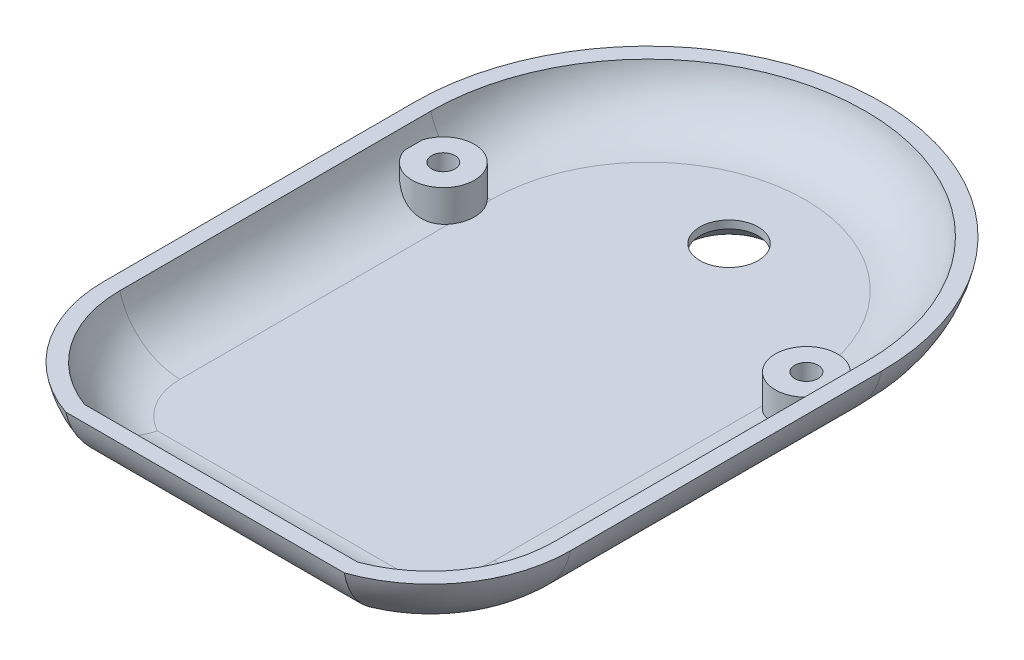
from build123d import *

# Parameters (mm, degrees)
EXTRUDE_1_DEPTH          = 8
FILLET_1_R               = 10
SHELL_2_T                = -2
EXTRUDE_2_REACH          = 73.465
SKETCH_2_R               = 4
SKETCH_2_R_2             = 1.5
SKETCH_3_R               = 7
EXTRUDE_5_DEPTH          = 1
CUT_EXTRUDE_2_DEPTH      = 70.685831359
CUT_EXTRUDE_2_DEPTH_BACK = 70.685831359
SKETCH_5_R               = 3.75
CHAMFER_3_SIZE           = 2


with BuildPart() as part:
    # 草图1 → 凸台-拉伸1 (new body)
    with BuildSketch(Plane(origin=(0, 0, 0), x_dir=(1, 0, 0), z_dir=(0, 1, 0))):
        with BuildLine():
            Line((-27.716535433, 33.464566929), (-27.716535433, -6.535433071))
            ThreePointArc((-27.716535433, -6.535433071), (-24.387756175, -16.964013125), (-15.632615216, -23.535433071))
            Line((-15.632615216, -23.535433071), (20.19954435, -23.535433071))
            ThreePointArc((20.19954435, -23.535433071), (28.954685308, -16.964013125), (32.283464567, -6.535433071))
            Line((32.283464567, -6.535433071), (32.283464567, 33.464566929))
            ThreePointArc((32.283464567, 33.464566929), (2.283464567, 63.464566929), (-27.716535433, 33.464566929))
        make_face()
    extrude(amount=EXTRUDE_1_DEPTH)

    # 圆角1
    # the kernel refuses this fillet: 10 mm, written as the material it takes off along each edge
    with BuildSketch(Plane(origin=(-40.127512644, 0, 23.535433071), x_dir=(0, 1, 0), z_dir=(1, 0, 0))) as fillet_1_piece_1:
        with BuildLine():
            CenterArc((10, -9.797958971), FILLET_1_R, 101.536959033, 78.463040967)
            Line((0, -9.797958971), (0, 0))
            Line((0, 0), (8, 0))
        make_face()
    extrude(amount=84.821954422, mode=Mode.SUBTRACT)
    # the kernel refuses this fillet: 10 mm, written as the material it takes off along each edge
    with BuildSketch(Plane(origin=(-27.716535433, 0, -33.464566929), x_dir=(0, 1, 0), z_dir=(0, 0, 1))) as fillet_1_2_piece_1:
        with BuildLine():
            CenterArc((10, -9.797958971), FILLET_1_R, 101.536959033, 78.463040967)
            Line((0, -9.797958971), (0, 0))
            Line((0, 0), (8, 0))
        make_face()
    extrude(amount=40, mode=Mode.SUBTRACT)
    with BuildSketch(Plane(origin=(-9.716535433, 0, 6.535433071), x_dir=(-1, 0, 0), z_dir=(0, 0, -1))) as fillet_1_2_piece_2:
        with BuildLine():
            CenterArc((8.202041029, 10), FILLET_1_R, 270, 78.463040967)
            Line((8.202041029, 0), (18, 0))
            Line((18, 0), (18, 8))
        make_face()
    revolve(axis=Axis((-9.716535433, 0, 6.535433071), (0, 1, 0)), revolution_arc=101.557097779, mode=Mode.SUBTRACT)
    with BuildSketch(Plane(origin=(14.283464567, 0, 6.535433071), x_dir=(-0.20034437358478865, 0, 0.9797255391041507), z_dir=(-0.9797255391041507, 0, -0.20034437358478865))) as fillet_1_2_piece_3:
        with BuildLine():
            CenterArc((8.202041029, 10), FILLET_1_R, 270, 78.463040967)
            Line((18, 8), (18, 0))
            Line((18, 0), (8.202041029, 0))
        make_face()
    revolve(axis=Axis((14.283464567, 0, 6.535433071), (0, 1, 0)), revolution_arc=101.557097779, mode=Mode.SUBTRACT)
    with BuildSketch(Plane(origin=(32.283464567, 0, 6.535433071), x_dir=(-1, 0, 0), z_dir=(0, 0, -1))) as fillet_1_2_piece_4:
        with BuildLine():
            CenterArc((9.797958971, 10), FILLET_1_R, 191.536959033, 78.463040967)
            Line((0, 8), (0, 0))
            Line((0, 0), (9.797958971, 0))
        make_face()
    extrude(amount=40, mode=Mode.SUBTRACT)
    with BuildSketch(Plane(origin=(2.283464567, 0, -33.464566929), x_dir=(1, 0, 0), z_dir=(0, 0, 1))) as fillet_1_2_piece_5:
        with BuildLine():
            CenterArc((20.202041029, 10), FILLET_1_R, 270, 78.463040967)
            Line((20.202041029, 0), (30, 0))
            Line((30, 0), (30, 8))
        make_face()
    revolve(axis=Axis((2.283464567, 0, -33.464566929), (0, 1, 0)), revolution_arc=180, mode=Mode.SUBTRACT)

    # 抽壳2
    shell_2_openings = [part.faces().sort_by_distance(p)[0] for p in [
        (2.283464567, 8, -17.884957719),
    ]]
    offset(amount=SHELL_2_T, openings=shell_2_openings)

    # 草图2 → 凸台-拉伸2 (add, up to next)
    with BuildSketch(Plane(origin=(0, 6.1, 0), x_dir=(1, 0, 0), z_dir=(0, 1, 0)), mode=Mode.PRIVATE) as extrude_2_sk1:
        with Locations((-21.066535433, 30.464566929)):
            Circle(SKETCH_2_R)
        with Locations(Location((-21.066535433, 30.464566929, 0), (0, 0, 270))):
            Circle(SKETCH_2_R_2, mode=Mode.SUBTRACT)
    extrude_2_tool1 = extrude(extrude_2_sk1.sketch, amount=-EXTRUDE_2_REACH, mode=Mode.PRIVATE) - part.part
    # 草图2 → 凸台-拉伸2 (add, up to next)
    with BuildSketch(Plane(origin=(0, 6.1, 0), x_dir=(1, 0, 0), z_dir=(0, 1, 0)), mode=Mode.PRIVATE) as extrude_2_sk2:
        with Locations((25.633464567, 30.464566929)):
            Circle(SKETCH_2_R)
        with Locations(Location((25.633464567, 30.464566929, 0), (0, 0, 270))):
            Circle(SKETCH_2_R_2, mode=Mode.SUBTRACT)
    extrude_2_tool2 = extrude(extrude_2_sk2.sketch, amount=-EXTRUDE_2_REACH, mode=Mode.PRIVATE) - part.part
    add(extrude_2_tool1.solids().sort_by_distance((-24.953398, 6.1, -30.464567))[0])
    add(extrude_2_tool2.solids().sort_by_distance((21.746602, 6.1, -30.464567))[0])

    # 草图3 → 凸台-拉伸5 (add)
    with BuildSketch(Plane(origin=(0, 0, 0), x_dir=(1, 0, 0), z_dir=(0, 1, 0))):
        with Locations(Location((2.283464567, 43.864566929, 0), (0, 0, 270))):
            Circle(SKETCH_3_R)
    extrude(amount=-EXTRUDE_5_DEPTH)

    # 草图5 → 切除-拉伸2 (cut, two sides: drawn at the far end of the back side and taken through both)
    with BuildSketch(Plane(origin=(0, 2, -2), x_dir=(-1, 0, 0), z_dir=(0, 1, 0)).offset(-CUT_EXTRUDE_2_DEPTH_BACK)):
        with Locations(Location((-2.283464567, -41.864566929, 0), (0, 0, 90))):
            Circle(SKETCH_5_R)
    extrude(amount=CUT_EXTRUDE_2_DEPTH + CUT_EXTRUDE_2_DEPTH_BACK, mode=Mode.SUBTRACT)

    # 倒角3
    chamfer_3_edges = [part.edges().sort_by_distance(p)[0] for p in [
        (2.283464567, -1, -47.614566929),
    ]]
    chamfer(chamfer_3_edges, length=CHAMFER_3_SIZE)


solid = part.part
